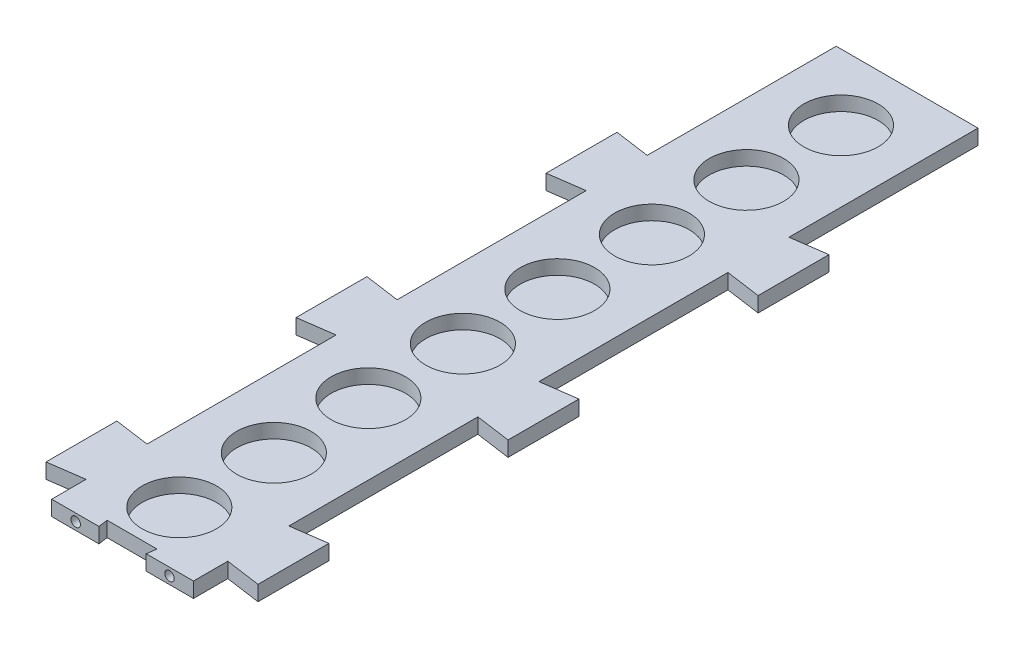
from build123d import *

# Parameters (mm, degrees)
SKETCH1_W           = 38.1
SKETCH1_H           = 391.16
BOSS_EXTRUDE1_DEPTH = 4.064
SKETCH2_R           = 10
CUT_EXTRUDE1_DEPTH  = 3.863999892
BOSS_EXTRUDE2_DEPTH = 4.064
SKETCH5_W           = 56.96460671
SKETCH5_H           = 4.064
CUT_EXTRUDE2_DEPTH  = 182.88
BOSS_EXTRUDE3_DEPTH = 4.064
SKETCH7_R           = 1.27
CUT_EXTRUDE3_DEPTH  = 12.7


with BuildPart() as part:
    # Sketch1 → Boss-Extrude1 (new body)
    with BuildSketch(Plane(origin=(0, 0, 0), x_dir=(1, 0, 0), z_dir=(0, 1, 0))):
        Rectangle(SKETCH1_W, SKETCH1_H)
    extrude(amount=BOSS_EXTRUDE1_DEPTH)

    # Sketch2 → Cut-Extrude1 (cut)
    with BuildSketch(Plane(origin=(0, 4.064, 0), x_dir=(1, 0, 0), z_dir=(0, 1, 0))):
        with Locations((0, 177.8)):
            Circle(SKETCH2_R)
        with Locations((0, 152.4)):
            Circle(SKETCH2_R)
        with Locations((0, 127)):
            Circle(SKETCH2_R)
        with Locations((0, 101.6)):
            Circle(SKETCH2_R)
        with Locations((0, 76.2)):
            Circle(SKETCH2_R)
        with Locations((0, 50.8)):
            Circle(SKETCH2_R)
        with Locations((0, 25.4)):
            Circle(SKETCH2_R)
        Circle(SKETCH2_R)
        with Locations((0, -25.4)):
            Circle(SKETCH2_R)
        with Locations((0, -50.8)):
            Circle(SKETCH2_R)
        with Locations((0, -76.2)):
            Circle(SKETCH2_R)
        with Locations((0, -101.6)):
            Circle(SKETCH2_R)
        with Locations((0, -127)):
            Circle(SKETCH2_R)
        with Locations((0, -152.4)):
            Circle(SKETCH2_R)
        with Locations((0, -177.8)):
            Circle(SKETCH2_R)
    extrude(amount=-CUT_EXTRUDE1_DEPTH, mode=Mode.SUBTRACT)

    # Sketch4 → Boss-Extrude2 (add)
    with BuildSketch(Plane(origin=(0, 0, 0), x_dir=(1, 0, 0), z_dir=(0, 1, 0))):
        Polygon((28.482303355, -55.490633493), (19.05, -56.81625728), (19.05, -73.215009707), (28.482303355, -74.540633493), align=None)
        Polygon((28.482303355, 146.105623787), (19.05, 144.78), (19.05, 128.381247573), (28.482303355, 127.055623787), align=None)
        Polygon((-19.05, 128.381247573), (-19.05, 144.78), (-28.482303355, 146.105623787), (-28.482303355, 127.055623787), align=None)
        Polygon((28.482303355, 78.90687136), (19.05, 77.581247573), (19.05, 61.182495147), (28.482303355, 59.85687136), align=None)
        Polygon((28.482303355, 11.708118933), (19.05, 10.382495147), (19.05, -6.01625728), (28.482303355, -7.341881067), align=None)
        Polygon((-19.05, -6.01625728), (-19.05, 10.382495147), (-28.482303355, 11.708118933), (-28.482303355, -7.341881067), align=None)
        Polygon((-19.05, 61.182495147), (-19.05, 77.581247573), (-28.482303355, 78.90687136), (-28.482303355, 59.85687136), align=None)
        Polygon((28.482303355, -122.68938592), (19.05, -124.015009707), (19.05, -140.413762134), (28.482303355, -141.73938592), align=None)
        Polygon((-19.05, -140.413762134), (-19.05, -124.015009707), (-28.482303355, -122.68938592), (-28.482303355, -141.73938592), align=None)
        Polygon((-19.05, -73.215009707), (-19.05, -56.81625728), (-28.482303355, -55.490633493), (-28.482303355, -74.540633493), align=None)
    extrude(amount=BOSS_EXTRUDE2_DEPTH)

    # Sketch5 → Cut-Extrude2 (cut)
    with BuildSketch(Plane.XY.offset(195.58)):
        with Locations((0, 2.032)):
            Rectangle(SKETCH5_W, SKETCH5_H)
    extrude(amount=-CUT_EXTRUDE2_DEPTH, mode=Mode.SUBTRACT)

    # Sketch6 → Boss-Extrude3 (add)
    with BuildSketch(Plane(origin=(0, 4.064, 0), x_dir=(1, 0, 0), z_dir=(0, 1, 0))):
        Polygon((-6.70697372, -12.7), (-6.35, -15.24), (-19.05, -15.24), (-19.05, -12.7), align=None)
        Polygon((19.05, -12.7), (19.05, -15.24), (6.35, -15.24), (6.70697372, -12.7), align=None)
    extrude(amount=-BOSS_EXTRUDE3_DEPTH)

    # Sketch7 → Cut-Extrude3 (cut)
    with BuildSketch(Plane.XY.offset(15.24)):
        with Locations((-12.607303355, 2.032)):
            Circle(SKETCH7_R)
        with Locations((12.607303355, 2.032)):
            Circle(SKETCH7_R)
    extrude(amount=-CUT_EXTRUDE3_DEPTH, mode=Mode.SUBTRACT)


solid = part.part
